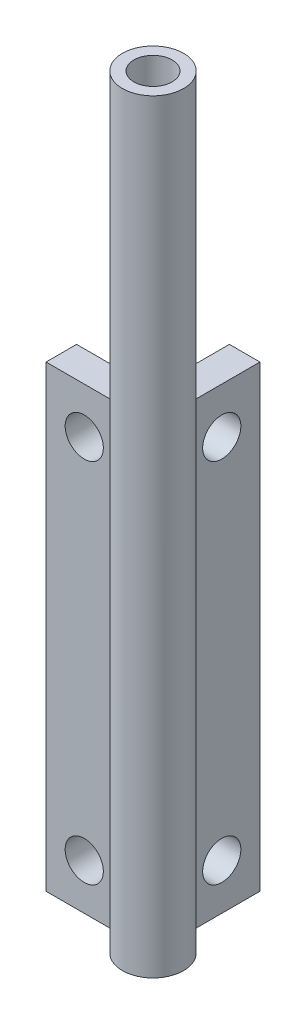
from build123d import *
from build123d.topology import SkipClean

# Parameters (mm, degrees)
SKETCH1_R           = 5.08
BOSS_EXTRUDE1_DEPTH = 127
SKETCH2_R           = 3.175
CUT_EXTRUDE1_DEPTH  = 128.203038
BOSS_EXTRUDE5_DEPTH = 76.2
CUT_EXTRUDE7_REACH  = 131.465
SKETCH12_R          = 3.175
CUT_EXTRUDE8_REACH  = 131.465
SKETCH13_R          = 3.175


with BuildPart() as part:
    # Sketch1 → Boss-Extrude1 (new body)
    with BuildSketch(Plane(origin=(0, 0, 0), x_dir=(1, 0, 0), z_dir=(0, 1, 0))):
        Circle(SKETCH1_R)
    extrude(amount=BOSS_EXTRUDE1_DEPTH)

    # Sketch2 → Cut-Extrude1 (cut, through all)
    with BuildSketch(Plane.XZ):
        Circle(SKETCH2_R)
    extrude(amount=-CUT_EXTRUDE1_DEPTH, mode=Mode.SUBTRACT)

    # Sketch11 → Boss-Extrude5 (add)
    with SkipClean():  # the faces are left unmerged after this step: merging them gives an invalid solid
        with BuildSketch(Plane.XZ):
            with BuildLine():
                Line((0, -17.78), (0, -5.08))
                Line((0, -5.08), (0, -3.175))
                ThreePointArc((0, -3.175), (-2.245064, -2.245064), (-3.175, 0))
                Line((-3.175, 0), (-5.08, 0))
                Line((-5.08, 0), (-17.78, 0))
                Line((-17.78, 0), (-17.78, -5.08))
                Line((-17.78, -5.08), (-5.08, -5.08))
                Line((-5.08, -5.08), (-5.08, -17.78))
                Line((-5.08, -17.78), (0, -17.78))
            make_face()
        extrude(amount=-BOSS_EXTRUDE5_DEPTH)

    # Sketch12 → Cut-Extrude7 (cut, up to next)
    with BuildSketch(Plane(origin=(0, 0, 0), x_dir=(0, 0, -1), z_dir=(1, 0, 0)), mode=Mode.PRIVATE) as cut_extrude7_sk1:
        with Locations((11.43, 7.62)):
            Circle(SKETCH12_R)
    cut_extrude7_tool1 = extrude(cut_extrude7_sk1.sketch, amount=-CUT_EXTRUDE7_REACH, mode=Mode.PRIVATE) & part.part
    cut_extrude7 = cut_extrude7_tool1.solids().sort_by_distance((0, 7.62, -11.43))[0]
    add(cut_extrude7, mode=Mode.SUBTRACT)

    # Sketch13 → Cut-Extrude8 (cut, up to next)
    with BuildSketch(Plane.XY, mode=Mode.PRIVATE) as cut_extrude8_sk1:
        with Locations((-11.43, 7.62)):
            Circle(SKETCH13_R)
    cut_extrude8_tool1 = extrude(cut_extrude8_sk1.sketch, amount=-CUT_EXTRUDE8_REACH, mode=Mode.PRIVATE) & part.part
    cut_extrude8 = cut_extrude8_tool1.solids().sort_by_distance((-11.43, 7.62, 0))[0]
    add(cut_extrude8, mode=Mode.SUBTRACT)

    # Mirror4: Cut-Extrude7, Cut-Extrude8 across plane
    with SkipClean():  # the faces are left unmerged after this step: merging them gives an invalid solid
        add(cut_extrude7.mirror(Plane(origin=(0, 38.1, 0), x_dir=(0, 0, 1), z_dir=(0, -1, 0))), mode=Mode.SUBTRACT)
        add(cut_extrude8.mirror(Plane(origin=(0, 38.1, 0), x_dir=(0, 0, 1), z_dir=(0, -1, 0))), mode=Mode.SUBTRACT)


solid = part.part
